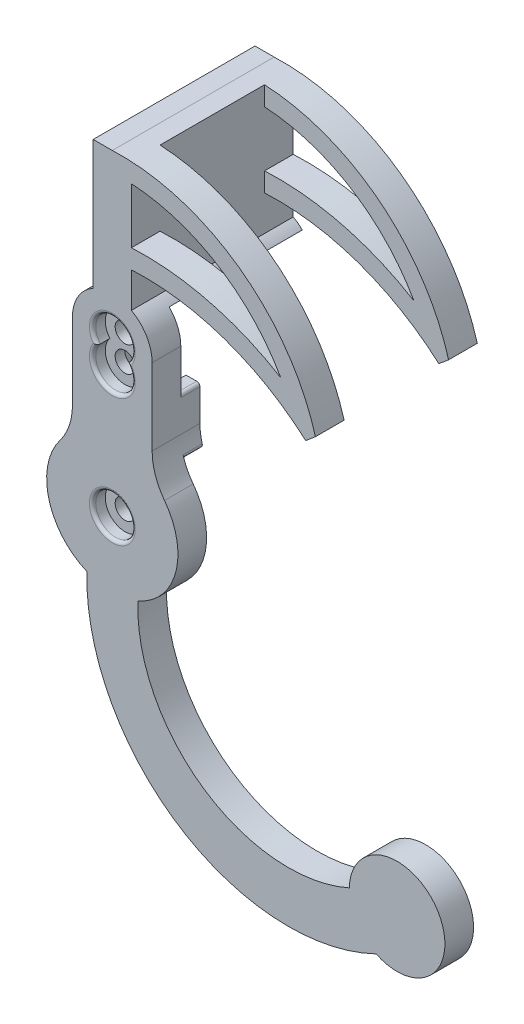
from build123d import *
from build123d.topology import SkipClean

# Parameters (mm, degrees)
SKETCH1_R           = 1.55
BOSS_EXTRUDE1_DEPTH = 3.5
BOSS_EXTRUDE2_START = -1
BOSS_EXTRUDE2_DEPTH = 1
BOSS_EXTRUDE3_START = 3
BOSS_EXTRUDE3_DEPTH = 3
SKETCH3_R           = 3.1
CUT_EXTRUDE1_DEPTH  = 2
CUT_EXTRUDE7_START  = 11
CUT_EXTRUDE7_DEPTH  = 11
BOSS_EXTRUDE4_START = -4.5
BOSS_EXTRUDE4_DEPTH = 4.5
BOSS_EXTRUDE5_START = -4.5
BOSS_EXTRUDE5_DEPTH = 4.5
BOSS_EXTRUDE6_START = 20.9
BOSS_EXTRUDE6_DEPTH = 20.9
CUT_EXTRUDE8_DEPTH  = 16.4
SKETCH13_R          = 1.55
CUT_EXTRUDE9_DEPTH  = 10
SKETCH14_R          = 3.1
CUT_EXTRUDE10_DEPTH = 2
FILLET2_R           = 0.5


# Read off the part's stored shape, not the designer's step: Boss-Extrude5
with BuildPart() as part:
    # Sketch1 → Boss-Extrude1 (new body)
    with BuildSketch(Plane.XY):
        with BuildLine():
            Line((-6.252777778, 12), (-6.252777778, 24))
            ThreePointArc((-6.252777778, 24), (0, 30.252777778), (6.252777778, 24))
            Line((6.252777778, 24), (6.252777778, 12))
            ThreePointArc((6.252777778, 12), (6.751601127, 8.96210288), (8.195687022, 6.24323187))
            ThreePointArc((8.195687022, 6.24323187), (0, -10.302777778), (-8.195687022, 6.24323187))
            ThreePointArc((-8.195687022, 6.24323187), (-6.751601127, 8.96210288), (-6.252777778, 12))
        make_face()
        with Locations(Location((0, 20, 0), (0, 0, 180))):
            Circle(SKETCH1_R, mode=Mode.SUBTRACT)
        with Locations(Location((0, 24, 0), (0, 0, 180))):
            Circle(SKETCH1_R, mode=Mode.SUBTRACT)
    extrude(amount=BOSS_EXTRUDE1_DEPTH)

    # Sketch1<6> → Boss-Extrude2 (add)
    with SkipClean():  # the faces are left unmerged after this step: merging them gives an invalid solid
        with BuildSketch(Plane.XY.offset(BOSS_EXTRUDE2_START)):
            with BuildLine():
                Line((-6.252777778, 24), (-6.252777778, 12))
                ThreePointArc((-6.252777778, 12), (-6.751601127, 8.96210288), (-8.195687022, 6.24323187))
                ThreePointArc((-8.195687022, 6.24323187), (0, -10.302777778), (8.195687022, 6.24323187))
                ThreePointArc((8.195687022, 6.24323187), (6.751601127, 8.96210288), (6.252777778, 12))
                Line((6.252777778, 12), (6.252777778, 24))
                ThreePointArc((6.252777778, 24), (0, 30.252777778), (-6.252777778, 24))
            make_face()
            with BuildLine():
                ThreePointArc((-3.740199612, 9.599902958), (-3.562277736, 10.794094226), (-3.502777778, 12))
                Line((-3.502777778, 12), (-3.35, 24))
                ThreePointArc((-3.35, 24), (0, 27.35), (3.35, 24))
                Line((3.35, 24), (3.502777778, 12))
                ThreePointArc((3.502777778, 12), (3.562277736, 10.794094226), (3.740199612, 9.599902958))
                ThreePointArc((3.740199612, 9.599902958), (4.521843537, 7.73681106), (5.173381632, 5.824331843))
                ThreePointArc((5.173381632, 5.824331843), (7.105921174, 3.192585661), (7.790168094, 0))
                ThreePointArc((7.790168094, 0), (-3.192585661, -7.105921174), (-5.173381632, 5.824331843))
                ThreePointArc((-5.173381632, 5.824331843), (-4.521843537, 7.73681106), (-3.740199612, 9.599902958))
            make_face(mode=Mode.SUBTRACT)
        extrude(amount=BOSS_EXTRUDE2_DEPTH)

    # Sketch2 → Boss-Extrude3 (add)
    with SkipClean():  # the faces are left unmerged after this step: merging them gives an invalid solid
        with BuildSketch(Plane(origin=(0, 0, -1), x_dir=(-1, 0, 0), z_dir=(0, 0, -1)).offset(BOSS_EXTRUDE3_START)):
            with BuildLine():
                Line((6.252777778, 17.500445731), (3.583193826, 17.466457972))
                Line((3.583193826, 17.466457972), (3.65286916, 11.993777148))
                ThreePointArc((3.65286916, 11.993777148), (3.756779571, 10.417642799), (4.065118793, 8.868474059))
                ThreePointArc((4.065118793, 8.868474059), (4.214668194, 8.512593617), (4.359521295, 8.154775937))
                Line((4.359521295, 8.154775937), (6.751601127, 8.96210288))
                ThreePointArc((6.751601127, 8.96210288), (6.378313042, 10.460710907), (6.252777778, 12))
                Line((6.252777778, 12), (6.252777778, 17.500445731))
            make_face()
            with BuildLine():
                Line((-3.583193826, 17.466457972), (-6.252777778, 17.500445731))
                Line((-6.252777778, 17.500445731), (-6.252777778, 12))
                ThreePointArc((-6.252777778, 12), (-6.378313042, 10.460710907), (-6.751601127, 8.96210288))
                Line((-6.751601127, 8.96210288), (-4.359521295, 8.154775937))
                ThreePointArc((-4.359521295, 8.154775937), (-4.214668194, 8.512593617), (-4.065118793, 8.868474059))
                ThreePointArc((-4.065118793, 8.868474059), (-3.756779571, 10.417642799), (-3.65286916, 11.993777148))
                Line((-3.65286916, 11.993777148), (-3.583193826, 17.466457972))
            make_face()
        extrude(amount=-BOSS_EXTRUDE3_DEPTH)

    # Sketch3 → Cut-Extrude1 (cut)
    with SkipClean():  # the faces are left unmerged after this step: merging them gives an invalid solid
        with BuildSketch(Plane.XY.offset(3.5)):
            with Locations((0, 20)):
                Circle(SKETCH3_R)
            with Locations((0, 24)):
                Circle(SKETCH3_R)
        extrude(amount=-CUT_EXTRUDE1_DEPTH, mode=Mode.SUBTRACT)

    # Sketch8 → Cut-Extrude7 (cut)
    with SkipClean():  # the faces are left unmerged after this step: merging them gives an invalid solid
        with BuildSketch(Plane(origin=(0, 0, 0), x_dir=(-1, 0, 0), z_dir=(0, 0, -1)).offset(CUT_EXTRUDE7_START)):
            with BuildLine():
                Line((7.223850112, 3.984782248), (4.457382043, 9))
                Line((4.457382043, 9), (3.75, 24))
                ThreePointArc((3.75, 24), (0, 27.75), (-3.75, 24))
                Line((-3.75, 24), (-4.457382043, 9))
                Line((-4.457382043, 9), (-7.223850112, 3.984782248))
                ThreePointArc((-7.223850112, 3.984782248), (0, -8.25), (7.223850112, 3.984782248))
            make_face()
            with BuildLine():
                Line((3.35, 24), (3.502777778, 12))
                ThreePointArc((3.502777778, 12), (3.562277736, 10.794094226), (3.740199612, 9.599902958))
                ThreePointArc((3.740199612, 9.599902958), (4.521843537, 7.73681106), (5.173381632, 5.824331843))
                ThreePointArc((5.173381632, 5.824331843), (0, -7.790168094), (-5.173381632, 5.824331843))
                ThreePointArc((-5.173381632, 5.824331843), (-4.521843537, 7.73681106), (-3.740199612, 9.599902958))
                ThreePointArc((-3.740199612, 9.599902958), (-3.562277736, 10.794094226), (-3.502777778, 12))
                Line((-3.502777778, 12), (-3.35, 24))
                ThreePointArc((-3.35, 24), (0, 27.35), (3.35, 24))
            make_face(mode=Mode.SUBTRACT)
        extrude(amount=-CUT_EXTRUDE7_DEPTH, mode=Mode.SUBTRACT)

    # Sketch4 → Boss-Extrude4 (add)
    with SkipClean():  # the faces are left unmerged after this step: merging them gives an invalid solid
        with BuildSketch(Plane.XY.offset(3.5).offset(BOSS_EXTRUDE4_START)):
            with BuildLine():
                Line((-3, 35), (-3, 29.486094233))
                ThreePointArc((-3, 29.486094233), (0, 30.252777778), (3, 29.486094233))
                Line((3, 29.486094233), (3, 35))
                ThreePointArc((3, 35), (17.611661727, 32.915742455), (30.356999166, 25.472546804))
                Line((30.356999166, 25.472546804), (31.889088052, 26.758122023))
                ThreePointArc((31.889088052, 26.758122023), (19.916717904, 43.757176376), (0, 49.726250325))
                Line((0, 49.726250325), (-3, 49.726250325))
                Line((-3, 49.726250325), (-3, 35))
            make_face()
            with BuildLine():
                ThreePointArc((26.443521088, 32.054775081), (15.166000225, 36.77990325), (3, 38.003729853))
                Line((3, 38.003729853), (3, 46.705586839))
                ThreePointArc((3, 46.705586839), (16.594325155, 42.376568373), (26.443521088, 32.054775081))
            make_face(mode=Mode.SUBTRACT)
        extrude(amount=BOSS_EXTRUDE4_DEPTH)

    # Boss-Extrude5 outline → Boss-Extrude5 (add)
    with SkipClean():  # the faces are left unmerged after this step: merging them gives an invalid solid
        with BuildSketch(Plane.XY.offset(3.5).offset(BOSS_EXTRUDE5_START)):
            with BuildLine():
                ThreePointArc((37.206668655, -31.914835371), (14.403856046, -29.887888853), (4.014024416, -9.488668923))
                ThreePointArc((4.014024416, -9.488668923), (0.013152601, -10.302769383), (-3.989784744, -9.498886653))
                ThreePointArc((-3.989784744, -9.498886653), (10.49194269, -36.890853177), (41.418876904, -38.778973849))
                ThreePointArc((41.418876904, -38.778973849), (51.098034229, -28.114827977), (37.206668655, -31.914835371))
            make_face()
        extrude(amount=BOSS_EXTRUDE5_DEPTH)

    # Sketch11 → Boss-Extrude6 (add)
    # profile 1 of 2: a face of its own
    with SkipClean():  # the faces are left unmerged after this step: merging them gives an invalid solid
        with BuildSketch(Plane(origin=(0, 0, -1), x_dir=(-1, 0, 0), z_dir=(0, 0, -1)).offset(BOSS_EXTRUDE6_START)):
            with BuildLine():
                Line((0, 49.726250325), (0, 27.75))
                ThreePointArc((0, 27.75), (1.435062871, 27.464548247), (2.651650429, 26.651650429))
                Line((2.651650429, 26.651650429), (4.421381568, 28.421381568))
                ThreePointArc((4.421381568, 28.421381568), (3.748683684, 29.00445807), (3, 29.486094233))
                Line((3, 29.486094233), (3, 49.726250325))
                Line((3, 49.726250325), (0, 49.726250325))
            make_face()
        # profile 2 of 2: a face of its own
        with BuildSketch(Plane(origin=(0, 0, -1), x_dir=(-1, 0, 0), z_dir=(0, 0, -1)).offset(BOSS_EXTRUDE6_START)):
            with BuildLine():
                ThreePointArc((-3, 29.486094233), (-3.748683684, 29.00445807), (-4.421381568, 28.421381568))
                Line((-4.421381568, 28.421381568), (-2.651650429, 26.651650429))
                ThreePointArc((-2.651650429, 26.651650429), (-1.435062871, 27.464548247), (0, 27.75))
                Line((0, 27.75), (0, 49.726250325))
                ThreePointArc((0, 49.726250325), (-19.916717904, 43.757176376), (-31.889088052, 26.758122023))
                Line((-31.889088052, 26.758122023), (-30.356999166, 25.472546804))
                ThreePointArc((-30.356999166, 25.472546804), (-17.611661727, 32.915742455), (-3, 35))
                Line((-3, 35), (-3, 29.486094233))
            make_face()
            with BuildLine():
                ThreePointArc((-26.443521088, 32.054775081), (-16.594325155, 42.376568373), (-3, 46.705586839))
                Line((-3, 46.705586839), (-3, 38.003729853))
                ThreePointArc((-3, 38.003729853), (-15.166000225, 36.77990325), (-26.443521088, 32.054775081))
            make_face(mode=Mode.SUBTRACT)
        extrude(amount=-BOSS_EXTRUDE6_DEPTH)

    # Sketch12 → Cut-Extrude8 (cut)
    with SkipClean():  # the faces are left unmerged after this step: merging them gives an invalid solid
        with BuildSketch(Plane(origin=(0, 0, -17.4), x_dir=(-1, 0, 0), z_dir=(0, 0, -1))):
            with BuildLine():
                Line((-3, 49.710165883), (-3, 35))
                ThreePointArc((-3, 35), (-17.611661727, 32.915742455), (-30.356999166, 25.472546804))
                Line((-30.356999166, 25.472546804), (-31.889088052, 26.758122023))
                ThreePointArc((-31.889088052, 26.758122023), (-21.113206485, 42.851785565), (-3, 49.710165883))
            make_face()
        extrude(amount=-CUT_EXTRUDE8_DEPTH, mode=Mode.SUBTRACT)

    # Sketch13 → Cut-Extrude9 (cut)
    with SkipClean():  # the faces are left unmerged after this step: merging them gives an invalid solid
        with BuildSketch(Plane.XY.offset(3.5)):
            Circle(SKETCH13_R)
        extrude(amount=-CUT_EXTRUDE9_DEPTH, mode=Mode.SUBTRACT)

    # Sketch14 → Cut-Extrude10 (cut)
    with SkipClean():  # the faces are left unmerged after this step: merging them gives an invalid solid
        with BuildSketch(Plane.XY.offset(3.5)):
            Circle(SKETCH14_R)
        extrude(amount=-CUT_EXTRUDE10_DEPTH, mode=Mode.SUBTRACT)

    # Fillet2
    # the kernel refuses this fillet: 0.5 mm, written as the material it takes off along each edge
    with BuildSketch(Plane(origin=(0, 24, 3.5), x_dir=(0.44840297352360914, -0.8938315128340382, 0), z_dir=(-0.8938315128340382, -0.44840297352360914, 0))) as fillet2_piece_1:
        with BuildLine():
            CenterArc((3.1 + FILLET2_R, -FILLET2_R), FILLET2_R, 90, 90)
            Line((3.1, -FILLET2_R), (3.1, 0))
            Line((3.1, 0), (3.1 + FILLET2_R, 0))
        make_face()
    revolve(axis=Axis((0, 24, 3.5), (0, 0, 1)), revolution_arc=306.717467059, mode=Mode.SUBTRACT)
    with BuildSketch(Plane(origin=(0, 20, 3.5), x_dir=(0.44840297352362823, 0.8938315128340286, 0), z_dir=(-0.8938315128340286, 0.44840297352362823, 0))) as fillet2_piece_2:
        with BuildLine():
            CenterArc((3.1 + FILLET2_R, FILLET2_R), FILLET2_R, 180, 90)
            Line((3.1, FILLET2_R), (3.1, 0))
            Line((3.1, 0), (3.1 + FILLET2_R, 0))
        make_face()
    revolve(axis=Axis((0, 20, 3.5), (0, 0, -1)), revolution_arc=306.717467059, mode=Mode.SUBTRACT)
    with BuildSketch(Plane(origin=(0, 0, 3.5), x_dir=(1, 0, 0), z_dir=(0, -1, 0))) as fillet2_piece_3:
        with BuildLine():
            CenterArc((3.1 + FILLET2_R, -FILLET2_R), FILLET2_R, 90, 90)
            Line((3.1, -FILLET2_R), (3.1, 0))
            Line((3.1, 0), (3.1 + FILLET2_R, 0))
        make_face()
    revolve(axis=Axis((0, 0, 3.5), (0, 0, 1)), mode=Mode.SUBTRACT)
    with BuildSketch(Plane(origin=(-6.751601127, 8.96210288, -5.218730444), x_dir=(0.9474922789871985, -0.31977864415818164, 0), z_dir=(0, 0, 1))) as fillet2_piece_4:
        with BuildLine():
            CenterArc((0.487492178, 0.5), FILLET2_R, 182.865983983, 87.134016017)
            ThreePointArc((-0.011882431, 0.475), (-0.002971072, 0.2375743), (0, 0))
            Line((0, 0), (0.487492178, 0))
        make_face()
    extrude(amount=4.218730444, mode=Mode.SUBTRACT)
    with BuildSketch(Plane(origin=(-6.252777778, 17.500445731, -5.266015654), x_dir=(0, -1, 0), z_dir=(0, 0, 1))) as fillet2_piece_5:
        with BuildLine():
            CenterArc((FILLET2_R * 1.01281252351, FILLET2_R), FILLET2_R, 179.270579253, 90.729420747)
            Line((FILLET2_R * 0.0128935589671, FILLET2_R * 1.01273044978), (0, 0))
            Line((0, 0), (FILLET2_R * 1.01281252351, 0))
        make_face()
    extrude(amount=4.266015654, mode=Mode.SUBTRACT)
    with BuildSketch(Plane(origin=(6.252777778, 17.500445731, -5.266015654), x_dir=(0, -1, 0), z_dir=(0, 0, 1))) as fillet2_piece_6:
        with BuildLine():
            CenterArc((FILLET2_R * 1.01281252351, -FILLET2_R), FILLET2_R, 90, 90.729420747)
            Line((FILLET2_R * 0.0128935589671, -FILLET2_R * 1.01273044978), (0, 0))
            Line((0, 0), (FILLET2_R * 1.01281252351, 0))
        make_face()
    extrude(amount=4.266015654, mode=Mode.SUBTRACT)
    with BuildSketch(Plane(origin=(6.751601127, 8.96210288, -5.218730444), x_dir=(-0.9474922789872003, -0.3197786441581759, 0), z_dir=(0, 0, 1))) as fillet2_piece_7:
        with BuildLine():
            CenterArc((0.487492178, -0.5), FILLET2_R, 90, 87.134016017)
            ThreePointArc((-0.011882431, -0.475), (-0.002971072, -0.2375743), (0, 0))
            Line((0, 0), (0.487492178, 0))
        make_face()
    extrude(amount=4.218730444, mode=Mode.SUBTRACT)


solid = part.part
